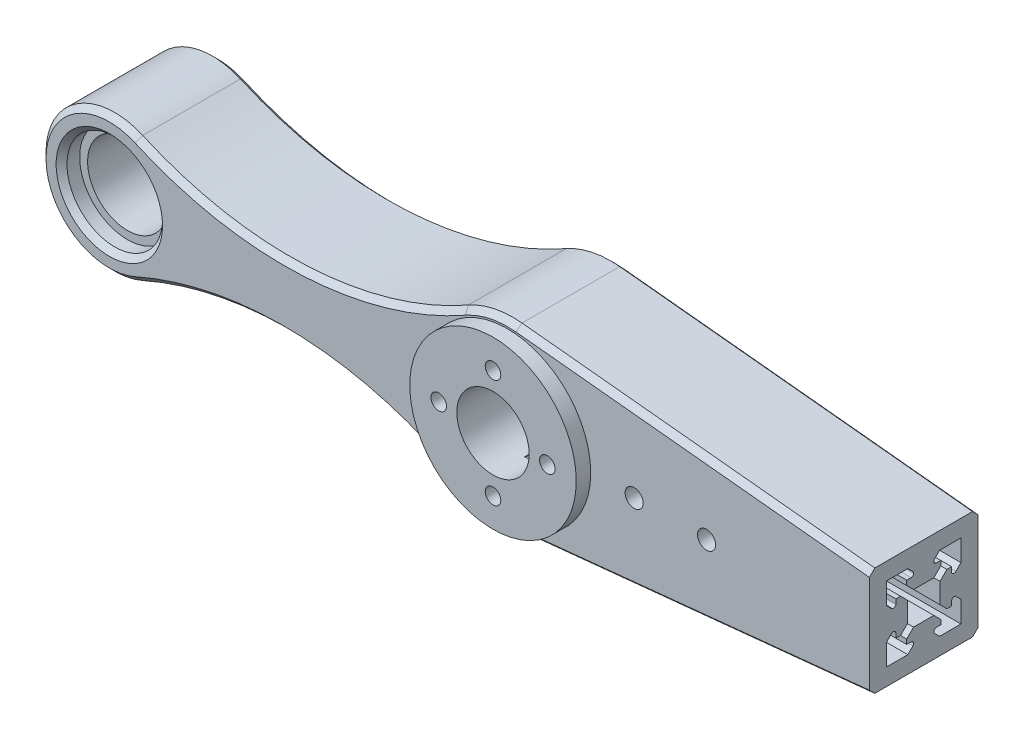
from build123d import *

# Parameters (mm, degrees)
SKETCH1_R           = 13.2
SKETCH1_R_2         = 2.5
SKETCH1_R_3         = 25
SKETCH1_R_4         = 2.15
SKETCH1_R_5         = 10
BOSS_EXTRUDE1_DEPTH = 30
CUT_EXTRUDE1_DEPTH  = 100
SKETCH5_R           = 23
SKETCH5_R_2         = 2.15
SKETCH5_R_3         = 10
BOSS_EXTRUDE2_DEPTH = 4
SKETCH6_R           = 4
CUT_EXTRUDE2_DEPTH  = 20
CHAMFER1_SIZE       = 1.5
BOSS_EXTRUDE3_START = -25
SKETCH7_R           = 13.2
SKETCH7_R_2         = 11
BOSS_EXTRUDE3_DEPTH = 20


with BuildPart() as part:
    # Sketch1 → Boss-Extrude1 (new body)
    # profile 1 of 3: a face of its own
    with BuildSketch(Plane.XY):
        with BuildLine():
            ThreePointArc((-12.330909091, -21.747383314), (-25, 0), (-12.330909091, 21.747383314))
            ThreePointArc((-12.330909091, 21.747383314), (-56.78426341, 8.855585216), (-102.280977846, 17.361356427))
            ThreePointArc((-102.280977846, 17.361356427), (-129, 0), (-102.280977846, -17.361356427))
            ThreePointArc((-102.280977846, -17.361356427), (-56.78426341, -8.855585216), (-12.330909091, -21.747383314))
        make_face()
        with Locations((-110, 0)):
            Circle(SKETCH1_R, mode=Mode.SUBTRACT)
    # profile 2 of 3: a face of its own
    with BuildSketch(Plane.XY):
        with BuildLine():
            Line((100, -15), (100, 15))
            Line((100, 15), (2.519085952, 24.872760321))
            ThreePointArc((2.519085952, 24.872760321), (18.546928975, 16.763395408), (25, 0))
            ThreePointArc((25, 0), (18.546928975, -16.763395408), (2.519085952, -24.872760321))
            Line((2.519085952, -24.872760321), (100, -15))
        make_face()
        with Locations((35, 0)):
            Circle(SKETCH1_R_2, mode=Mode.SUBTRACT)
        with Locations((55, 0)):
            Circle(SKETCH1_R_2, mode=Mode.SUBTRACT)
    # profile 3 of 3: a face of its own
    with BuildSketch(Plane.XY):
        Circle(SKETCH1_R_3)
        with Locations((-15, 0)):
            Circle(SKETCH1_R_4, mode=Mode.SUBTRACT)
        with Locations((0, -15)):
            Circle(SKETCH1_R_4, mode=Mode.SUBTRACT)
        with Locations((15, 0)):
            Circle(SKETCH1_R_4, mode=Mode.SUBTRACT)
        with Locations((0, 15)):
            Circle(SKETCH1_R_4, mode=Mode.SUBTRACT)
        Circle(SKETCH1_R_5, mode=Mode.SUBTRACT)
    extrude(amount=BOSS_EXTRUDE1_DEPTH)

    # Sketch3 → Cut-Extrude1 (cut)
    with BuildSketch(Plane(origin=(100, 0, 0), x_dir=(0, 0, -1), z_dir=(1, 0, 0))):
        with BuildLine():
            Line((-12.197056275, 4.5), (-17.802943725, 4.5))
            Line((-17.802943725, 4.5), (-19.710050506, 6.407106781))
            Line((-19.710050506, 6.407106781), (-19.710050506, 7.7))
            Line((-19.710050506, 7.7), (-18.482842712, 7.7))
            ThreePointArc((-18.482842712, 7.7), (-17.83612704, 8.132121597), (-17.987867966, 8.894974747))
            Line((-17.987867966, 8.894974747), (-19.387867966, 10.294974747))
            Line((-19.387867966, 10.294974747), (-25.294974747, 10.294974747))
            Line((-25.294974747, 10.294974747), (-25.294974747, 4.387867966))
            Line((-25.294974747, 4.387867966), (-23.894974747, 2.987867966))
            ThreePointArc((-23.894974747, 2.987867966), (-23.132121597, 2.83612704), (-22.7, 3.482842712))
            Line((-22.7, 3.482842712), (-22.7, 4.710050506))
            Line((-22.7, 4.710050506), (-21.407106781, 4.710050506))
            Line((-21.407106781, 4.710050506), (-19.5, 2.802943725))
            Line((-19.5, 2.802943725), (-19.5, -2.802943725))
            Line((-19.5, -2.802943725), (-21.407106781, -4.710050506))
            Line((-21.407106781, -4.710050506), (-22.7, -4.710050506))
            Line((-22.7, -4.710050506), (-22.7, -3.482842712))
            ThreePointArc((-22.7, -3.482842712), (-23.132121597, -2.83612704), (-23.894974747, -2.987867966))
            Line((-23.894974747, -2.987867966), (-25.294974747, -4.387867966))
            Line((-25.294974747, -4.387867966), (-25.294974747, -10.294974747))
            Line((-25.294974747, -10.294974747), (-19.387867966, -10.294974747))
            Line((-19.387867966, -10.294974747), (-17.987867966, -8.894974747))
            ThreePointArc((-17.987867966, -8.894974747), (-17.83612704, -8.132121597), (-18.482842712, -7.7))
            Line((-18.482842712, -7.7), (-19.710050506, -7.7))
            Line((-19.710050506, -7.7), (-19.710050506, -6.407106781))
            Line((-19.710050506, -6.407106781), (-17.802943725, -4.5))
            Line((-17.802943725, -4.5), (-12.197056275, -4.5))
            Line((-12.197056275, -4.5), (-10.289949494, -6.407106781))
            Line((-10.289949494, -6.407106781), (-10.289949494, -7.7))
            Line((-10.289949494, -7.7), (-11.517157288, -7.7))
            ThreePointArc((-11.517157288, -7.7), (-12.16387296, -8.132121597), (-12.012132034, -8.894974747))
            Line((-12.012132034, -8.894974747), (-10.612132034, -10.294974747))
            Line((-10.612132034, -10.294974747), (-4.705025253, -10.294974747))
            Line((-4.705025253, -10.294974747), (-4.705025253, -4.387867966))
            Line((-4.705025253, -4.387867966), (-6.105025253, -2.987867966))
            ThreePointArc((-6.105025253, -2.987867966), (-6.867878403, -2.83612704), (-7.3, -3.482842712))
            Line((-7.3, -3.482842712), (-7.3, -4.710050506))
            Line((-7.3, -4.710050506), (-8.592893219, -4.710050506))
            Line((-8.592893219, -4.710050506), (-10.5, -2.802943725))
            Line((-10.5, -2.802943725), (-10.5, 2.802943725))
            Line((-10.5, 2.802943725), (-8.592893219, 4.710050506))
            Line((-8.592893219, 4.710050506), (-7.3, 4.710050506))
            Line((-7.3, 4.710050506), (-7.3, 3.482842712))
            ThreePointArc((-7.3, 3.482842712), (-6.867878403, 2.83612704), (-6.105025253, 2.987867966))
            Line((-6.105025253, 2.987867966), (-4.705025253, 4.387867966))
            Line((-4.705025253, 4.387867966), (-4.705025253, 10.294974747))
            Line((-4.705025253, 10.294974747), (-10.612132034, 10.294974747))
            Line((-10.612132034, 10.294974747), (-12.012132034, 8.894974747))
            ThreePointArc((-12.012132034, 8.894974747), (-12.16387296, 8.132121597), (-11.517157288, 7.7))
            Line((-11.517157288, 7.7), (-10.289949494, 7.7))
            Line((-10.289949494, 7.7), (-10.289949494, 6.407106781))
            Line((-10.289949494, 6.407106781), (-12.197056275, 4.5))
        make_face()
    extrude(amount=-CUT_EXTRUDE1_DEPTH, mode=Mode.SUBTRACT)

    # Sketch5 → Boss-Extrude2 (add)
    with BuildSketch(Plane.XY.offset(30)):
        Circle(SKETCH5_R)
        with Locations((0, -15)):
            Circle(SKETCH5_R_2, mode=Mode.SUBTRACT)
        with Locations(Location((15, 0, 0), (0, 0, 270))):
            Circle(SKETCH5_R_2, mode=Mode.SUBTRACT)
        with Locations((0, 15)):
            Circle(SKETCH5_R_2, mode=Mode.SUBTRACT)
        with Locations((-15, 0)):
            Circle(SKETCH5_R_2, mode=Mode.SUBTRACT)
        Circle(SKETCH5_R_3, mode=Mode.SUBTRACT)
    extrude(amount=BOSS_EXTRUDE2_DEPTH)

    # Sketch6 → Cut-Extrude2 (cut)
    with BuildSketch(Plane(origin=(0, 0, 0), x_dir=(-1, 0, 0), z_dir=(0, 0, -1))):
        with Locations((0, 15)):
            Circle(SKETCH6_R)
        with Locations((15, 0)):
            Circle(SKETCH6_R)
        with Locations((0, -15)):
            Circle(SKETCH6_R)
        with Locations((-15, 0)):
            Circle(SKETCH6_R)
    extrude(amount=-CUT_EXTRUDE2_DEPTH, mode=Mode.SUBTRACT)

    # Chamfer1
    # the kernel refuses this chamfer: 1.5 mm, written as the material it takes off along each edge
    with BuildSketch(Plane(origin=(-110, 0, 30), x_dir=(1, 0, 0), z_dir=(0, -1, 0))) as chamfer1_piece_1:
        Polygon((13.2 + CHAMFER1_SIZE, 0), (13.2, -CHAMFER1_SIZE), (13.2, 0), align=None)
    revolve(axis=Axis((-110, 0, 30), (0, 0, 1)), mode=Mode.SUBTRACT)
    with BuildSketch(Plane(origin=(-110, 0, 30), x_dir=(0.4062643239113793, 0.913755601414749, 0), z_dir=(0.913755601414749, -0.4062643239113793, 0))) as chamfer1_piece_2:
        Polygon((19 - CHAMFER1_SIZE, 0), (19, -CHAMFER1_SIZE), (19, 0), align=None)
    revolve(axis=Axis((-110, 0, 30), (0, 0, 1)), revolution_arc=227.940760951, mode=Mode.SUBTRACT)
    with BuildSketch(Plane(origin=(0, 0, 0), x_dir=(1, 0, 0), z_dir=(0, -1, 0))) as chamfer1_piece_3:
        Polygon((10, CHAMFER1_SIZE), (10 + CHAMFER1_SIZE, 0), (10, 0), align=None)
    revolve(axis=Axis((0, 0, 0), (0, 0, 1)), mode=Mode.SUBTRACT)
    with BuildSketch(Plane(origin=(-61.654545455, 108.736916568, 0), x_dir=(0.4932363636363673, -0.8698953325468377, 0), z_dir=(0.8698953325468377, 0.4932363636363673, 0))) as chamfer1_piece_4:
        Polygon((100, -CHAMFER1_SIZE), (100 + CHAMFER1_SIZE, 0), (100, 0), align=None)
    revolve(axis=Axis((-61.654545455, 108.736916568, 0), (0, 0, -1)), revolution_arc=53.52390173, mode=Mode.SUBTRACT)
    with BuildSketch(Plane(origin=(-61.654545455, -108.736916568, 30), x_dir=(-0.40626432391138556, 0.9137556014147463, 0), z_dir=(-0.9137556014147463, -0.40626432391138556, 0))) as chamfer1_piece_5:
        Polygon((100 + CHAMFER1_SIZE, 0), (100, CHAMFER1_SIZE), (100, 0), align=None)
    revolve(axis=Axis((-61.654545455, -108.736916568, 30), (0, 0, -1)), revolution_arc=53.52390173, mode=Mode.SUBTRACT)
    with BuildSketch(Plane(origin=(0, 0, 0), x_dir=(0.10076343807629276, 0.9949104128247152, 0), z_dir=(0.9949104128247152, -0.10076343807629276, 0))) as chamfer1_piece_6:
        Polygon((25, CHAMFER1_SIZE), (25 - CHAMFER1_SIZE, 0), (25, 0), align=None)
    revolve(axis=Axis((0, 0, 0), (0, 0, 1)), revolution_arc=35.336655573, mode=Mode.SUBTRACT)
    with BuildSketch(Plane(origin=(103.837891275, 14.611302571, 0), x_dir=(0.0027705790602042895, 0.027355933949616756, 0.9996219169112968), z_dir=(-0.9949104128247152, 0.10076343807629269, 0)), Plane(origin=(2.519085952, -24.872760321, 0), x_dir=(0.002770579060204136, -0.02735593394961524, 0.9996219169112968), z_dir=(0.9949104128247152, 0.10076343807629269, 0)), Plane(origin=(103.837891275, 14.611302571, 30), x_dir=(-0.10072534112439643, -0.9945342540228512, 0.02749587661058676), z_dir=(-0.9949104128247152, 0.10076343807629269, 0))) as chamfer1_piece_7:
        Polygon((CHAMFER1_SIZE * 0.999621916911, -CHAMFER1_SIZE * 0.0274958766106), (-CHAMFER1_SIZE * 0.0274958766106, -CHAMFER1_SIZE * 0.999621916911), (0, 0), align=None)
    extrude(amount=101.837114193, mode=Mode.SUBTRACT)
    with BuildSketch(Plane(origin=(0, 0, 0), x_dir=(-0.4932363636363602, -0.8698953325468417, 0), z_dir=(-0.8698953325468417, 0.4932363636363602, 0))) as chamfer1_piece_8:
        Polygon((25 - CHAMFER1_SIZE, 0), (25, CHAMFER1_SIZE), (25, 0), align=None)
    revolve(axis=Axis((0, 0, 0), (0, 0, 1)), revolution_arc=35.336655573, mode=Mode.SUBTRACT)
    with BuildSketch(Plane(origin=(-61.654545455, -108.736916568, 0), x_dir=(-0.40626432391138556, 0.9137556014147463, 0), z_dir=(-0.9137556014147463, -0.40626432391138556, 0))) as chamfer1_piece_9:
        Polygon((100, -CHAMFER1_SIZE), (100 + CHAMFER1_SIZE, 0), (100, 0), align=None)
    revolve(axis=Axis((-61.654545455, -108.736916568, 0), (0, 0, -1)), revolution_arc=53.52390173, mode=Mode.SUBTRACT)
    with BuildSketch(Plane(origin=(-110, 0, 0), x_dir=(0.4062643239113793, 0.913755601414749, 0), z_dir=(0.913755601414749, -0.4062643239113793, 0))) as chamfer1_piece_10:
        Polygon((19, CHAMFER1_SIZE), (19 - CHAMFER1_SIZE, 0), (19, 0), align=None)
    revolve(axis=Axis((-110, 0, 0), (0, 0, 1)), revolution_arc=227.940760951, mode=Mode.SUBTRACT)
    with BuildSketch(Plane(origin=(-110, 0, 0), x_dir=(1, 0, 0), z_dir=(0, -1, 0))) as chamfer1_piece_11:
        Polygon((13.2, CHAMFER1_SIZE), (13.2 + CHAMFER1_SIZE, 0), (13.2, 0), align=None)
    revolve(axis=Axis((-110, 0, 0), (0, 0, 1)), mode=Mode.SUBTRACT)
    with BuildSketch(Plane(origin=(0, 0, 30), x_dir=(-0.4932363636363602, -0.8698953325468417, 0), z_dir=(-0.8698953325468417, 0.4932363636363602, 0))) as chamfer1_piece_12:
        Polygon((25 - CHAMFER1_SIZE, 0), (25, -CHAMFER1_SIZE), (25, 0), align=None)
    revolve(axis=Axis((0, 0, 30), (0, 0, 1)), revolution_arc=35.336655573, mode=Mode.SUBTRACT)
    with BuildSketch(Plane(origin=(2.519085952, -24.872760321, 30), x_dir=(0.0027705790602041347, -0.02735593394961523, -0.9996219169112968), z_dir=(0.9949104128247152, 0.10076343807629269, 0))) as chamfer1_piece_13:
        Polygon((CHAMFER1_SIZE * 0.999621916911, CHAMFER1_SIZE * 0.0274958766106), (-CHAMFER1_SIZE * 0.0274958766106, CHAMFER1_SIZE * 0.999621916911), (0, 0), align=None)
    extrude(amount=101.837114193, mode=Mode.SUBTRACT)
    with BuildSketch(Plane(origin=(0, 0, 30), x_dir=(0.10076343807629276, 0.9949104128247152, 0), z_dir=(0.9949104128247152, -0.10076343807629276, 0))) as chamfer1_piece_14:
        Polygon((25 - CHAMFER1_SIZE, 0), (25, -CHAMFER1_SIZE), (25, 0), align=None)
    revolve(axis=Axis((0, 0, 30), (0, 0, 1)), revolution_arc=35.336655573, mode=Mode.SUBTRACT)
    with BuildSketch(Plane(origin=(-61.654545455, 108.736916568, 30), x_dir=(0.4932363636363673, -0.8698953325468377, 0), z_dir=(0.8698953325468377, 0.4932363636363673, 0))) as chamfer1_piece_15:
        Polygon((100 + CHAMFER1_SIZE, 0), (100, CHAMFER1_SIZE), (100, 0), align=None)
    revolve(axis=Axis((-61.654545455, 108.736916568, 30), (0, 0, -1)), revolution_arc=53.52390173, mode=Mode.SUBTRACT)

    # Sketch7 → Boss-Extrude3 (add)
    with BuildSketch(Plane.XY.offset(30).offset(BOSS_EXTRUDE3_START)):
        with Locations((-110, 0)):
            Circle(SKETCH7_R)
        with Locations((-110, 0)):
            Circle(SKETCH7_R_2, mode=Mode.SUBTRACT)
    extrude(amount=BOSS_EXTRUDE3_DEPTH)


solid = part.part
